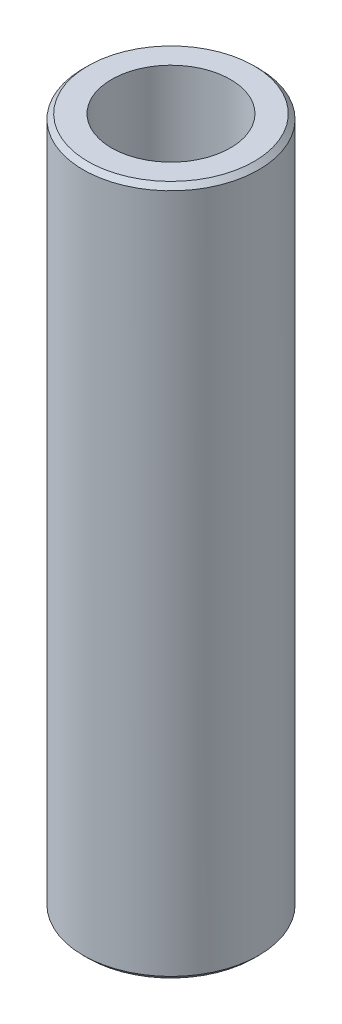
from build123d import *

# Parameters (mm, degrees)
SKETCH1_R           = 35
BOSS_EXTRUDE1_DEPTH = 275.203548064
SKETCH2_R           = 23.69918824
CUT_EXTRUDE1_DEPTH  = 280.619371409
CHAMFER1_SIZE       = 1.901672972


with BuildPart() as part:
    # Sketch1 → Boss-Extrude1 (new body)
    with BuildSketch(Plane(origin=(0, 0, 0), x_dir=(1, 0, 0), z_dir=(0, 1, 0))):
        Circle(SKETCH1_R)
    extrude(amount=BOSS_EXTRUDE1_DEPTH)

    # Sketch2 → Cut-Extrude1 (cut, through all)
    with BuildSketch(Plane(origin=(0, 0, 0), x_dir=(1, 0, 0), z_dir=(0, 1, 0))):
        Circle(SKETCH2_R)
    extrude(amount=CUT_EXTRUDE1_DEPTH, mode=Mode.SUBTRACT)

    # Chamfer1
    chamfer1_edges = [part.edges().sort_by_distance(p)[0] for p in [
        (-35, 275.203548064, 0),
        (-35, 0, 0),
    ]]
    chamfer(chamfer1_edges, length=CHAMFER1_SIZE)


solid = part.part
